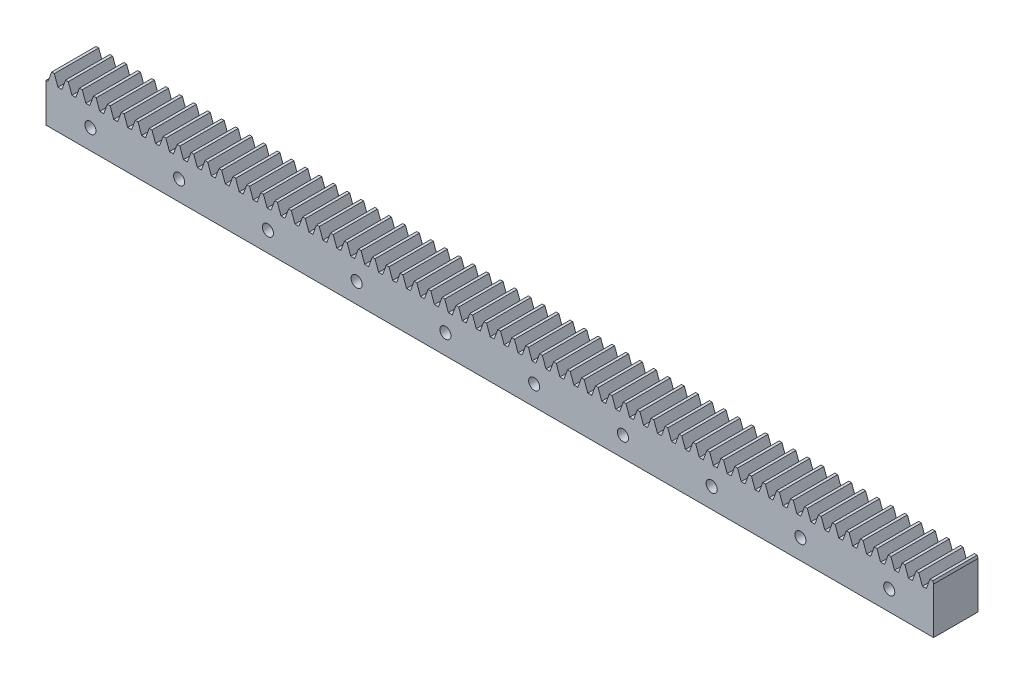
from build123d import *

# Parameters (mm, degrees)
BLANKSKE_W             = 200
BLANKSKE_H             = 11
BLANK_DEPTH            = 10
TOOTHCUTSIM_DEPTH      = 201.55173896
TEETHCUTS_COUNT        = 97
TEETHCUTS_PITCH        = 3.14159265
M3X0_5_1_D             = 2.5
PATTERN_LINEAR_1_COUNT = 15
PATTERN_LINEAR_1_PITCH = 20


with BuildPart() as part:
    # BlankSke → Blank (new body)
    with BuildSketch(Plane.XY):
        with Locations((100, 5.5)):
            Rectangle(BLANKSKE_W, BLANKSKE_H)
    extrude(amount=-BLANK_DEPTH)

    # TooCutSkeSim → ToothCutSim (cut, through all)
    with BuildSketch(Plane.XY):
        Polygon((0.44443537, 8.75), (-0.44443537, 8.75), (-1.272613241, 11.0254), (1.272613241, 11.0254), align=None)
    toothcutsim = extrude(amount=-TOOTHCUTSIM_DEPTH, mode=Mode.SUBTRACT)

    # TeethCuts: ToothCutSim ×97
    with Locations(*[(i * TEETHCUTS_PITCH, 0, 0) for i in range(1, TEETHCUTS_COUNT)]):
        add(toothcutsim, mode=Mode.SUBTRACT)

    # M3x0.5 螺紋孔1 (through all)
    with Locations(Plane(origin=(10, 4.5, 0), x_dir=(1, 0, 0), z_dir=(0, 0, 1))):
        with Locations((0, 0)):
            m3x0_5_1 = Hole(M3X0_5_1_D / 2)

    # 直線複製排列1: M3x0.5 螺紋孔1 ×15
    with Locations(*[(i * PATTERN_LINEAR_1_PITCH, 0, 0) for i in range(1, PATTERN_LINEAR_1_COUNT)]):
        add(m3x0_5_1, mode=Mode.SUBTRACT)


solid = part.part
